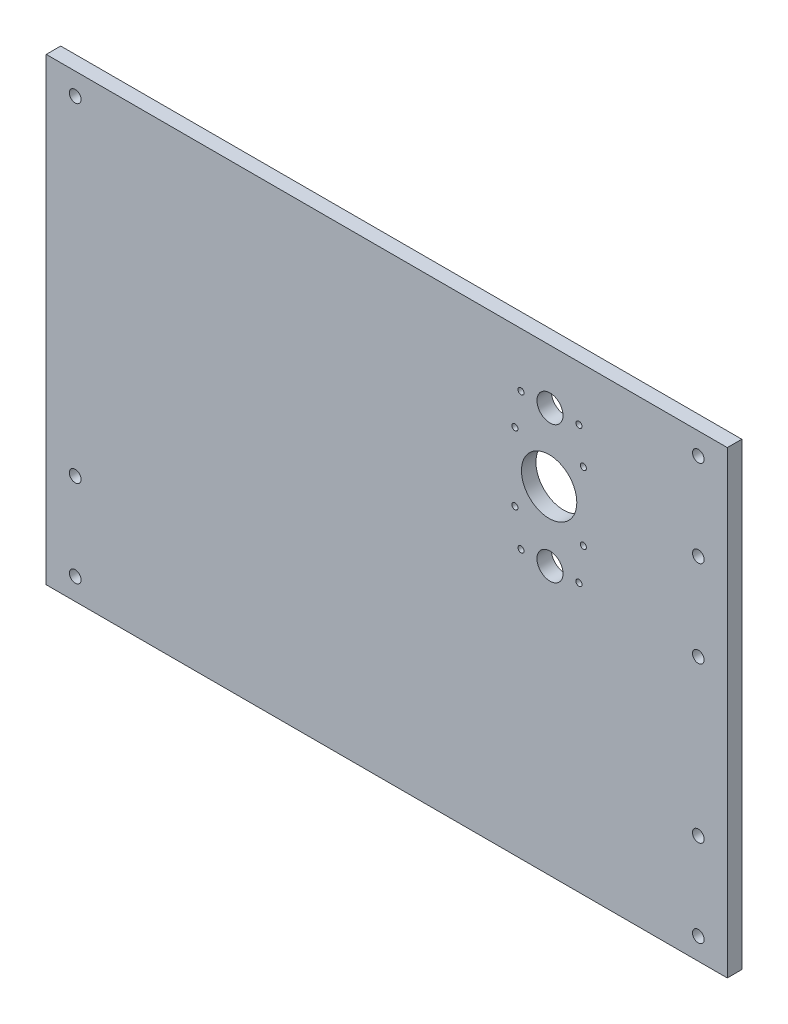
from build123d import *

# Parameters (mm, degrees)
SKETCH2_W           = 470
SKETCH2_H           = 317
BOSS_EXTRUDE1_DEPTH = 5
SKETCH3_R           = 4.05
CUT_EXTRUDE1_DEPTH  = 10
SKETCH4_R           = 9
SKETCH4_R_2         = 2.1
CUT_EXTRUDE2_DEPTH  = 284.632244288
SKETCH7_R           = 19.1
CUT_EXTRUDE5_DEPTH  = 284.632244288
SKETCH9_R           = 2.1
CUT_EXTRUDE7_DEPTH  = 284.632244288
SKETCH10_R          = 4
CUT_EXTRUDE8_DEPTH  = 284.632244288
LPATTERN1_COUNT     = 3
LPATTERN1_PITCH     = 60


with BuildPart() as part:
    # Sketch2 → Boss-Extrude1 (new, symmetric)
    with BuildSketch(Plane.XY):
        Rectangle(SKETCH2_W, SKETCH2_H)
    extrude(amount=BOSS_EXTRUDE1_DEPTH, both=True)

    # Sketch3 → Cut-Extrude1 (cut)
    with BuildSketch(Plane.XY.offset(5)):
        with Locations((-215, -83.5)):
            Circle(SKETCH3_R)
        with Locations((-215, -143.5)):
            Circle(SKETCH3_R)
        with Locations((215, -83.5)):
            Circle(SKETCH3_R)
        with Locations((215, -143.5)):
            Circle(SKETCH3_R)
        with Locations((-215, 143.5)):
            Circle(SKETCH3_R)
    extrude(amount=-CUT_EXTRUDE1_DEPTH, mode=Mode.SUBTRACT)

    # Sketch4 → Cut-Extrude2 (cut, through all)
    with BuildSketch(Plane.XY.offset(5)):
        with Locations((112.65, 121)):
            Circle(SKETCH4_R)
        with Locations((112.65, 26.5)):
            Circle(SKETCH4_R)
        with Locations((92.65, 121)):
            Circle(SKETCH4_R_2)
        with Locations((132.65, 121)):
            Circle(SKETCH4_R_2)
        with Locations((132.65, 26.5)):
            Circle(SKETCH4_R_2)
        with Locations((92.65, 26.5)):
            Circle(SKETCH4_R_2)
    extrude(amount=-CUT_EXTRUDE2_DEPTH, mode=Mode.SUBTRACT)

    # Sketch7 → Cut-Extrude5 (cut, through all)
    with BuildSketch(Plane.XY.offset(5)):
        with Locations((112.05, 73.75)):
            Circle(SKETCH7_R)
    extrude(amount=-CUT_EXTRUDE5_DEPTH, mode=Mode.SUBTRACT)

    # Sketch9 → Cut-Extrude7 (cut, through all)
    with BuildSketch(Plane.XY.offset(5)):
        with Locations((88.45, 97.35)):
            Circle(SKETCH9_R)
        with Locations((135.65, 97.35)):
            Circle(SKETCH9_R)
        with Locations((135.65, 50.15)):
            Circle(SKETCH9_R)
        with Locations((88.45, 50.15)):
            Circle(SKETCH9_R)
    extrude(amount=-CUT_EXTRUDE7_DEPTH, mode=Mode.SUBTRACT)

    # Sketch10 → Cut-Extrude8 (cut, through all)
    with BuildSketch(Plane.XY.offset(5)):
        with Locations((215, 143.5)):
            Circle(SKETCH10_R)
    cut_extrude8 = extrude(amount=-CUT_EXTRUDE8_DEPTH, mode=Mode.SUBTRACT)

    # LPattern1: Cut-Extrude8 ×3
    with Locations(*[(0, -i * LPATTERN1_PITCH, 0) for i in range(1, LPATTERN1_COUNT)]):
        add(cut_extrude8, mode=Mode.SUBTRACT)


solid = part.part
